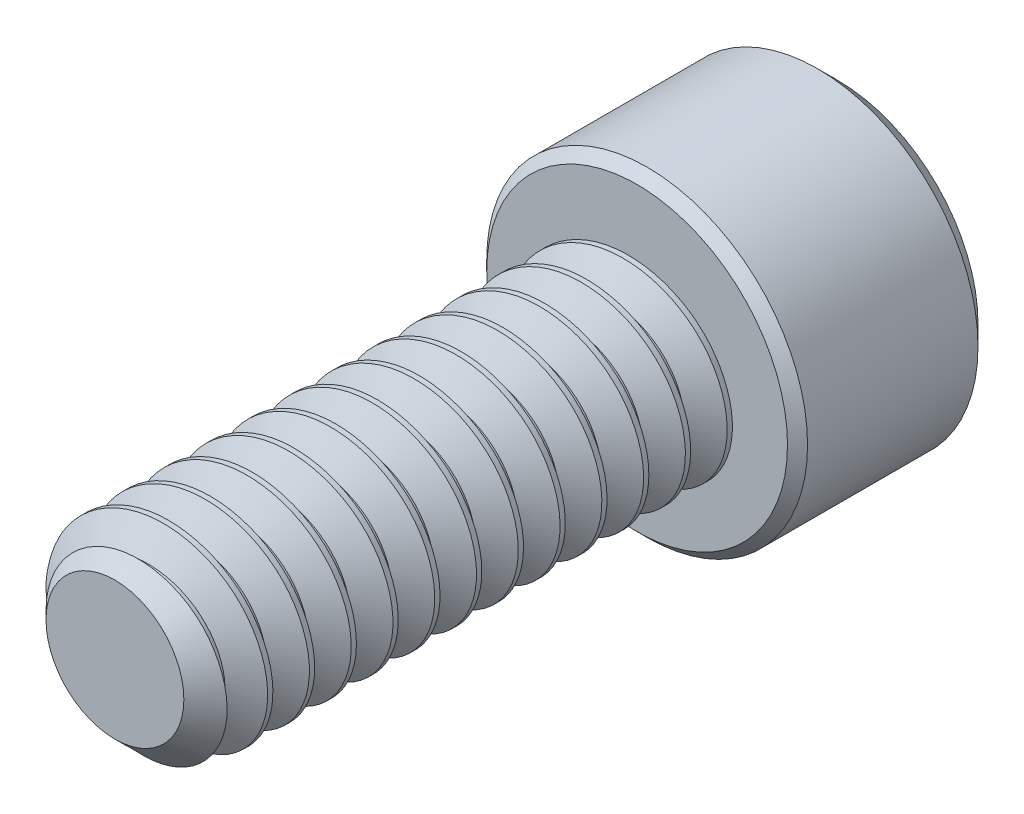
from build123d import *

# Parameters (mm, degrees)
SKETCH1_R          = 0.762
EXTRUDE1_DEPTH     = 3.96875
CHAMFER3_SIZE      = 0.238125
CUT_SWEEP1_PITCH   = 0.3175
SKETCH6_R          = 1.2192
EXTRUDE2_DEPTH     = 1.524
CUT_EXTRUDE1_DEPTH = 0.9525
SKETCH8_R          = 0.733234842
CUT_EXTRUDE2_DEPTH = 0.1524
CUT_EXTRUDE2_DRAFT = -45
CHAMFER1_SIZE      = 0.1524
CHAMFER2_SIZE      = 0.0762


with BuildPart() as part:
    # Sketch1 → Extrude1 (new body)
    with BuildSketch(Plane.XY):
        Circle(SKETCH1_R)
    extrude(amount=-EXTRUDE1_DEPTH)

    # Chamfer3
    chamfer3_edges = [part.edges().sort_by_distance(p)[0] for p in [
        (-0.762, 0, 0),
    ]]
    chamfer(chamfer3_edges, length=CHAMFER3_SIZE)

    # Cut-Sweep1: the profile of Sketch3 profile screwed along a right-hand helix of 13.5 turns, 6 arcs to a turn; built about Z, then put on its axis
    cut_sweep1_z = Axis((0, 0, 0), (0, 0, 1))
    cut_sweep1_corners = [(0.7623, 0, -0.277985705), (0.555777701, 0, -0.15875), (0.555777701, 0, -0.1190625), (0.7623, 0, 0.000173205)]
    with BuildLine(mode=Mode.PRIVATE) as cut_sweep1_profile:
        Line(cut_sweep1_corners[0], cut_sweep1_corners[1])
        Line(cut_sweep1_corners[1], cut_sweep1_corners[2])
        Line(cut_sweep1_corners[2], cut_sweep1_corners[3])
        Line(cut_sweep1_corners[3], cut_sweep1_corners[0])
    cut_sweep1_cap = Face(cut_sweep1_profile.wire())
    cut_sweep1_turn_angles = [0, 30, 60, 90, 120, 150, 180, 210, 240, 270, 300, 330, 360]
    cut_sweep1_turn_weights = [1, 0.8660254037844387, 1, 0.8660254037844387, 1, 0.8660254037844387, 1, 0.8660254037844387, 1, 0.8660254037844387, 1, 0.8660254037844387, 1]
    cut_sweep1_turn_rails = [Edge.make_bspline([Vector(p[0], p[1], 0).rotate(cut_sweep1_z, cut_sweep1_turn_angles[k]) / cut_sweep1_turn_weights[k] + Vector(0, 0, p[2] + CUT_SWEEP1_PITCH * cut_sweep1_turn_angles[k] / 360) for k in range(13)], [0, 0, 0, 1, 1, 2, 2, 3, 3, 4, 4, 5, 5, 6, 6, 6], 2, cut_sweep1_turn_weights) for p in cut_sweep1_corners]
    cut_sweep1_turn_sides = [Face.make_surface_from_curves(cut_sweep1_turn_rails[p[0]], cut_sweep1_turn_rails[p[1]]) for p in [(0, 1), (1, 2), (2, 3), (3, 0)]]
    cut_sweep1_last_angles = [4680, 4710, 4740, 4770, 4800, 4830, 4860]
    cut_sweep1_last_weights = [1, 0.8660254037844387, 1, 0.8660254037844387, 1, 0.8660254037843712, 1]
    cut_sweep1_last_rails = [Edge.make_bspline([Vector(p[0], p[1], 0).rotate(cut_sweep1_z, cut_sweep1_last_angles[k]) / cut_sweep1_last_weights[k] + Vector(0, 0, p[2] + CUT_SWEEP1_PITCH * cut_sweep1_last_angles[k] / 360) for k in range(7)], [0, 0, 0, 1, 1, 2, 2, 3, 3, 3], 2, cut_sweep1_last_weights) for p in cut_sweep1_corners]
    cut_sweep1_last_sides = [Face.make_surface_from_curves(cut_sweep1_last_rails[p[0]], cut_sweep1_last_rails[p[1]]) for p in [(0, 1), (1, 2), (2, 3), (3, 0)]]
    cut_sweep1 = Plane(origin=(0, 0, 0), x_dir=(0, 1, 0), z_dir=(0, 0, -1)) * Solid(Shell([*[p.moved(Location((0, 0, CUT_SWEEP1_PITCH * i))) for i in range(13) for p in cut_sweep1_turn_sides], *cut_sweep1_last_sides, cut_sweep1_cap, cut_sweep1_cap.rotate(cut_sweep1_z, 4860).moved(Location((0, 0, CUT_SWEEP1_PITCH * 4860 / 360)))]))
    add(cut_sweep1, mode=Mode.SUBTRACT)

    # Sketch6 → Extrude2 (add)
    with BuildSketch(Plane(origin=(0, 0, -3.96875), x_dir=(-1, 0, 0), z_dir=(0, 0, -1))):
        with Locations(Location((0, 0, 0), (0, 0, 180))):
            Circle(SKETCH6_R)
    extrude(amount=EXTRUDE2_DEPTH)

    # Sketch7 → Cut-Extrude1 (cut)
    with BuildSketch(Plane(origin=(0, 0, -5.49275), x_dir=(-1, 0, 0), z_dir=(0, 0, -1))):
        Polygon((0, 0.733234842), (-0.635, 0.366617421), (-0.635, -0.366617421), (0, -0.733234842), (0.635, -0.366617421), (0.635, 0.366617421), align=None)
    extrude(amount=-CUT_EXTRUDE1_DEPTH, mode=Mode.SUBTRACT)


with BuildPart() as cut_extrude2_tool:
    # Sketch8 → Cut-Extrude2 (with draft: the straight prism first)
    with BuildSketch(Plane(origin=(0, 0, -5.49275), x_dir=(-1, 0, 0), z_dir=(0, 0, -1))):
        Circle(SKETCH8_R)
    extrude(amount=-CUT_EXTRUDE2_DEPTH)
    # Cut-Extrude2: the draft: its side faces are tilted about the plane it starts from
    cut_extrude2_sides = [cut_extrude2_tool.faces().sort_by_distance(p)[0] for p in [
        (0.733234842, 0, -5.41655),
    ]]
    draft(cut_extrude2_sides, Plane(origin=(0, 0, -5.49275), x_dir=(-1, 0, 0), z_dir=(0, 0, -1)), CUT_EXTRUDE2_DRAFT)


with BuildPart() as part_1:
    add(part.part)

    # Cut-Extrude2: cut by cut_extrude2_tool
    add(cut_extrude2_tool.part, mode=Mode.SUBTRACT)

    # Chamfer1
    chamfer1_edges = [part_1.edges().sort_by_distance(p)[0] for p in [
        (-1.2192, 0, -5.49275),
    ]]
    chamfer(chamfer1_edges, length=CHAMFER1_SIZE)

    # Chamfer2
    chamfer2_edges = [part_1.edges().sort_by_distance(p)[0] for p in [
        (-1.2192, 0, -3.96875),
    ]]
    chamfer(chamfer2_edges, length=CHAMFER2_SIZE)


solid = part_1.part
